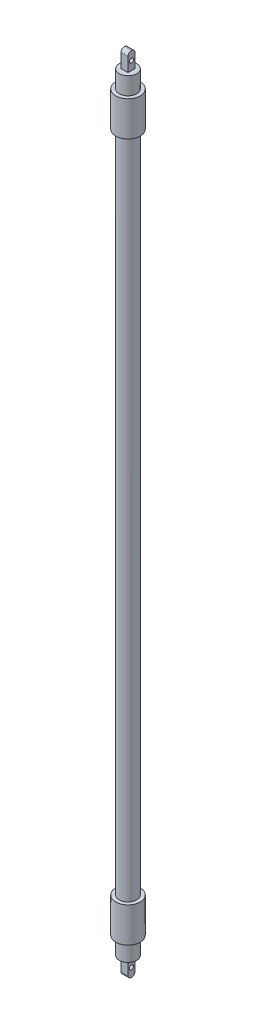
from build123d import *

# Parameters (mm, degrees)
CROQUIS1_R               = 2.5
SALIENTE_EXTRUIR6_DEPTH  = 190
CROQUIS4_R               = 3.5
SALIENTE_EXTRUIR7_DEPTH  = 10
CROQUIS5_R               = 2.5
SALIENTE_EXTRUIR9_DEPTH  = 5
SALIENTE_EXTRUIR10_START = 10
CROQUIS6_R               = 3.5
SALIENTE_EXTRUIR10_DEPTH = 10
SALIENTE_EXTRUIR11_START = 5
CROQUIS7_R               = 2.5
SALIENTE_EXTRUIR11_DEPTH = 5
SALIENTE_EXTRUIR12_DEPTH = 1
CROQUIS10_R              = 0.6
CORTAR_EXTRUIR1_DEPTH    = 12.5
REDONDEO3_R              = 1
REDONDEO4_R              = 1


with BuildPart() as part:
    # Croquis1 → Saliente-Extruir6 (new body)
    with BuildSketch(Plane(origin=(0, 0, 0), x_dir=(1, 0, 0), z_dir=(0, 1, 0))):
        with Locations(Location((0, 0, 0), (0, 0, 270))):
            Circle(CROQUIS1_R)
    extrude(amount=SALIENTE_EXTRUIR6_DEPTH)

    # Croquis4 → Saliente-Extruir7 (add)
    with BuildSketch(Plane(origin=(0, 190, 0), x_dir=(1, 0, 0), z_dir=(0, 1, 0))):
        with Locations(Location((0, 0, 0), (0, 0, 270))):
            Circle(CROQUIS4_R)
    extrude(amount=SALIENTE_EXTRUIR7_DEPTH)

    # Croquis5 → Saliente-Extruir9 (add)
    with BuildSketch(Plane(origin=(0, 200, 0), x_dir=(1, 0, 0), z_dir=(0, 1, 0))):
        with Locations(Location((0, 0, 0), (0, 0, 270))):
            Circle(CROQUIS5_R)
    extrude(amount=SALIENTE_EXTRUIR9_DEPTH)

    # Croquis6 → Saliente-Extruir10 (add)
    with BuildSketch(Plane.XZ.offset(SALIENTE_EXTRUIR10_START)):
        with Locations(Location((0, 0, 0), (0, 0, 90))):
            Circle(CROQUIS6_R)
    extrude(amount=-SALIENTE_EXTRUIR10_DEPTH)

    # Croquis7 → Saliente-Extruir11 (add)
    with BuildSketch(Plane.XZ.offset(10).offset(SALIENTE_EXTRUIR11_START)):
        with Locations(Location((0, 0, 0), (0, 0, 270))):
            Circle(CROQUIS7_R)
    extrude(amount=-SALIENTE_EXTRUIR11_DEPTH)

    # Croquis8 → Saliente-Extruir12 (add, symmetric)
    with BuildSketch(Plane.XY):
        Polygon((1, 210), (-1, 210), (-1, 205), (0, 205), (1, 205), align=None)
        Polygon((0, -15), (1, -15), (1, -20), (-1, -20), (-1, -15), align=None)
    extrude(amount=SALIENTE_EXTRUIR12_DEPTH, both=True)

    # Croquis10 → Cortar-Extruir1 (cut, symmetric)
    with BuildSketch(Plane(origin=(0, 0, 0), x_dir=(0, 0, -1), z_dir=(1, 0, 0))):
        with Locations((0, -17.5)):
            Circle(CROQUIS10_R)
        with Locations(Location((0, 207.5, 0), (0, 0, 90))):
            Circle(CROQUIS10_R)
    extrude(amount=CORTAR_EXTRUIR1_DEPTH, both=True, mode=Mode.SUBTRACT)

    # Redondeo3
    redondeo3_edges = [part.edges().sort_by_distance(p)[0] for p in [
        (0, -20, 1),
    ]]
    fillet(redondeo3_edges, radius=REDONDEO3_R)

    # Redondeo4
    redondeo4_edges = [part.edges().sort_by_distance(p)[0] for p in [
        (0, 210, 1),
        (0, 210, -1),
        (0, -20, -1),
    ]]
    fillet(redondeo4_edges, radius=REDONDEO4_R - 0.0001)  # a hair under: the kernel refuses the full size


solid = part.part
